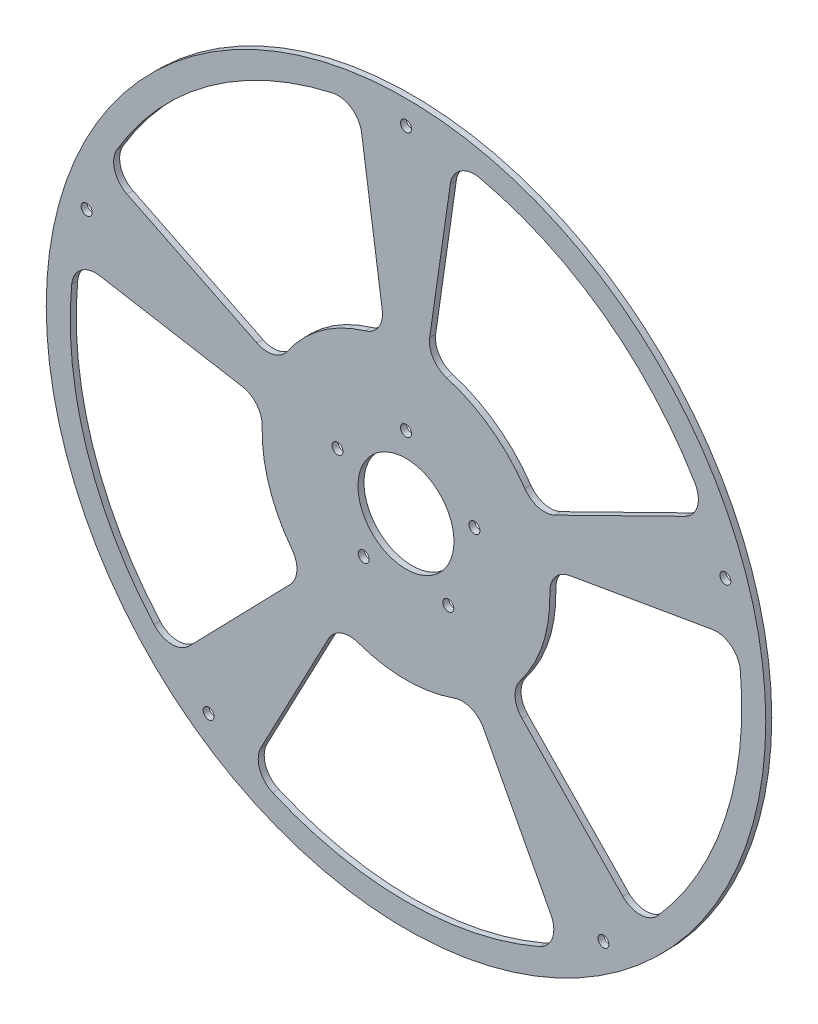
from build123d import *

# Parameters (mm, degrees)
SKETCH1_R           = 190.5
SKETCH1_R_2         = 25.4
SKETCH1_R_3         = 2.9
BOSS_EXTRUDE3_DEPTH = 3.175
FILLET1_R           = 12.7
FILLET2_R           = 12.7
FILLET3_R           = 12.7


with BuildPart() as part:
    # Sketch1 → Boss-Extrude3 (new body)
    with BuildSketch(Plane.XY):
        Circle(SKETCH1_R)
        Circle(SKETCH1_R_2, mode=Mode.SUBTRACT)
        with Locations((-36.235253271, 11.773547486)):
            Circle(SKETCH1_R_3, mode=Mode.SUBTRACT)
        with Locations((-22.394618112, -30.823547486)):
            Circle(SKETCH1_R_3, mode=Mode.SUBTRACT)
        with Locations((22.394618112, -30.823547486)):
            Circle(SKETCH1_R_3, mode=Mode.SUBTRACT)
        with Locations((36.235253271, 11.773547486)):
            Circle(SKETCH1_R_3, mode=Mode.SUBTRACT)
        with Locations((0, 38.1)):
            Circle(SKETCH1_R_3, mode=Mode.SUBTRACT)
        with Locations((-169.097848597, 54.9432216)):
            Circle(SKETCH1_R_3, mode=Mode.SUBTRACT)
        with Locations((0, 177.8)):
            Circle(SKETCH1_R_3, mode=Mode.SUBTRACT)
        with Locations((169.097848597, 54.9432216)):
            Circle(SKETCH1_R_3, mode=Mode.SUBTRACT)
        with Locations((104.508217858, -143.8432216)):
            Circle(SKETCH1_R_3, mode=Mode.SUBTRACT)
        with Locations((-104.508217858, -143.8432216)):
            Circle(SKETCH1_R_3, mode=Mode.SUBTRACT)
        with BuildLine():
            Line((25.335121222, 175.985714286), (10.857909095, 75.42244898))
            ThreePointArc((10.857909095, 75.42244898), (44.789236225, 61.647094971), (68.375733143, 33.63330369))
            Line((68.375733143, 33.63330369), (159.543377334, 78.477708611))
            ThreePointArc((159.543377334, 78.477708611), (104.508217858, 143.8432216), (25.335121222, 175.985714286))
        make_face(mode=Mode.SUBTRACT)
        with BuildLine():
            Line((-25.4, 175.976362049), (-10.885714286, 75.418440878))
            ThreePointArc((-10.885714286, 75.418440878), (-44.800599154, 61.63883772), (-68.375733143, 33.63330369))
            Line((-68.375733143, 33.63330369), (-159.543377334, 78.477708611))
            ThreePointArc((-159.543377334, 78.477708611), (-104.53473136, 143.823954679), (-25.4, 175.976362049))
        make_face(mode=Mode.SUBTRACT)
        with BuildLine():
            Line((75.086290011, 12.980333294), (175.201343359, 30.287444352))
            ThreePointArc((175.201343359, 30.287444352), (169.097848597, -54.9432216), (123.938351095, -127.483823005))
            Line((123.938351095, -127.483823005), (53.116436183, -54.635924145))
            ThreePointArc((53.116436183, -54.635924145), (72.470506542, -23.547094971), (75.086290011, 12.980333294))
        make_face(mode=Mode.SUBTRACT)
        with BuildLine():
            Line((35.547970221, -67.400161819), (82.945263848, -157.267044244))
            ThreePointArc((82.945263848, -157.267044244), (0, -177.8), (-82.945263848, -157.267044244))
            Line((-82.945263848, -157.267044244), (-35.547970221, -67.400161819))
            ThreePointArc((-35.547970221, -67.400161819), (0, -76.2), (35.547970221, -67.400161819))
        make_face(mode=Mode.SUBTRACT)
        with BuildLine():
            Line((-175.201343359, 30.287444352), (-75.086290011, 12.980333294))
            ThreePointArc((-75.086290011, 12.980333294), (-72.470506542, -23.547094971), (-53.116436183, -54.635924145))
            Line((-53.116436183, -54.635924145), (-123.938351095, -127.483823005))
            ThreePointArc((-123.938351095, -127.483823005), (-169.097848597, -54.9432216), (-175.201343359, 30.287444352))
        make_face(mode=Mode.SUBTRACT)
    extrude(amount=BOSS_EXTRUDE3_DEPTH)

    # Fillet1
    fillet1_edges = [part.edges().sort_by_distance(p)[0] for p in [
        (-175.201343359, 30.287444352, 1.5875),
    ]]
    fillet(fillet1_edges, radius=FILLET1_R)

    # Fillet2
    fillet2_edges = [part.edges().sort_by_distance(p)[0] for p in [
        (35.547970221, -67.400161819, 1.5875),
        (123.938351095, -127.483823005, 1.5875),
        (53.116436183, -54.635924145, 1.5875),
        (75.086290011, 12.980333294, 1.5875),
        (175.201343359, 30.287444352, 1.5875),
        (68.375733143, 33.63330369, 1.5875),
        (159.543377334, 78.477708611, 1.5875),
        (25.335121222, 175.985714286, 1.5875),
        (10.857909095, 75.42244898, 1.5875),
        (-10.885714286, 75.418440878, 1.5875),
        (-68.375733143, 33.63330369, 1.5875),
        (-25.4, 175.976362049, 1.5875),
        (-159.543377334, 78.477708611, 1.5875),
    ]]
    fillet(fillet2_edges, radius=FILLET2_R)

    # Fillet3
    fillet3_edges = [part.edges().sort_by_distance(p)[0] for p in [
        (-75.086290011, 12.980333294, 1.5875),
        (-123.938351095, -127.483823005, 1.5875),
        (-53.116436183, -54.635924145, 1.5875),
        (82.945263848, -157.267044244, 1.5875),
        (-82.945263848, -157.267044244, 1.5875),
        (-35.547970221, -67.400161819, 1.5875),
    ]]
    fillet(fillet3_edges, radius=FILLET3_R)


solid = part.part
